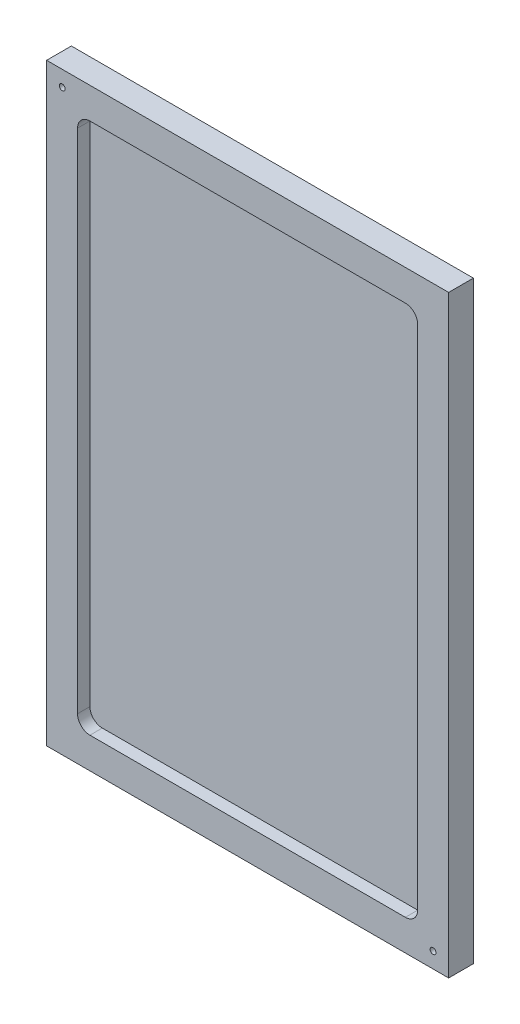
from build123d import *

# Parameters (mm, degrees)
SKETCH1_W                    = 206.375
SKETCH1_H                    = 304.8
BOSS_EXTRUDE1_DEPTH          = 12.7
CUT_EXTRUDE1_DEPTH           = 6.35
F_3_0_3_DIAMETER_HOLE1_D     = 3
F_3_0_3_DIAMETER_HOLE1_DEPTH = 5
F_3_0_3_DIAMETER_HOLE1_TIP   = 0.901290929


with BuildPart() as part:
    # Sketch1 → Boss-Extrude1 (new body)
    with BuildSketch(Plane.XY):
        Rectangle(SKETCH1_W, SKETCH1_H)
    extrude(amount=BOSS_EXTRUDE1_DEPTH)

    # Sketch2 → Cut-Extrude1 (cut)
    with BuildSketch(Plane.XY.offset(12.7)):
        with BuildLine():
            Line((80.9625, -136.525), (-80.9625, -136.525))
            ThreePointArc((-80.9625, -136.525), (-85.452628061, -134.665128061), (-87.3125, -130.175))
            Line((-87.3125, -130.175), (-87.3125, 130.175))
            ThreePointArc((-87.3125, 130.175), (-85.452628061, 134.665128061), (-80.9625, 136.525))
            Line((-80.9625, 136.525), (80.9625, 136.525))
            ThreePointArc((80.9625, 136.525), (85.452628061, 134.665128061), (87.3125, 130.175))
            Line((87.3125, 130.175), (87.3125, -130.175))
            ThreePointArc((87.3125, -130.175), (85.452628061, -134.665128061), (80.9625, -136.525))
        make_face()
    extrude(amount=-CUT_EXTRUDE1_DEPTH, mode=Mode.SUBTRACT)

    # Ø3.0 (3) Diameter Hole1
    with Locations(Plane(origin=(-95.1875, 144.4, 12.7), x_dir=(1, 0, 0), z_dir=(0, 0, 1))):
        with Locations((0, 0), (190.375, -288.8)):
            Hole(F_3_0_3_DIAMETER_HOLE1_D / 2, depth=F_3_0_3_DIAMETER_HOLE1_DEPTH)
            with Locations((0, 0, -(F_3_0_3_DIAMETER_HOLE1_DEPTH + F_3_0_3_DIAMETER_HOLE1_TIP / 2))):  # 118° drill point
                Cone(0, F_3_0_3_DIAMETER_HOLE1_D / 2, F_3_0_3_DIAMETER_HOLE1_TIP, mode=Mode.SUBTRACT)


solid = part.part
